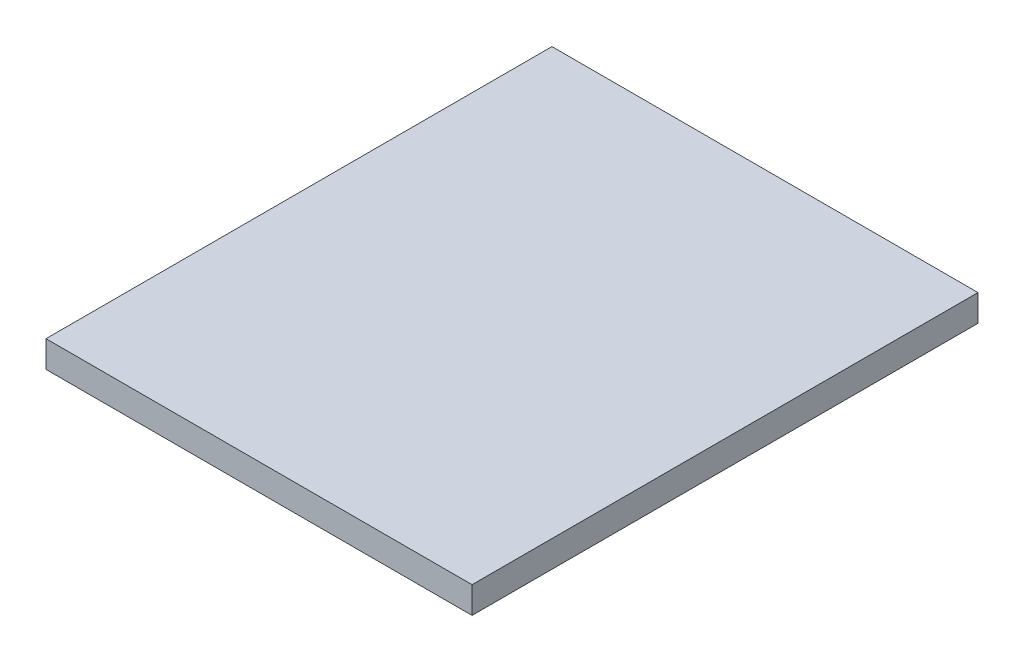
from build123d import *

# Parameters (mm, degrees)
SKETCH1_W           = 50.8
SKETCH1_H           = 60.325
BOSS_EXTRUDE1_DEPTH = 3.175


with BuildPart() as part:
    # Sketch1 → Boss-Extrude1 (new body)
    with BuildSketch(Plane(origin=(0, 0, 0), x_dir=(1, 0, 0), z_dir=(0, 1, 0))):
        Rectangle(SKETCH1_W, SKETCH1_H)
    extrude(amount=BOSS_EXTRUDE1_DEPTH)


solid = part.part
